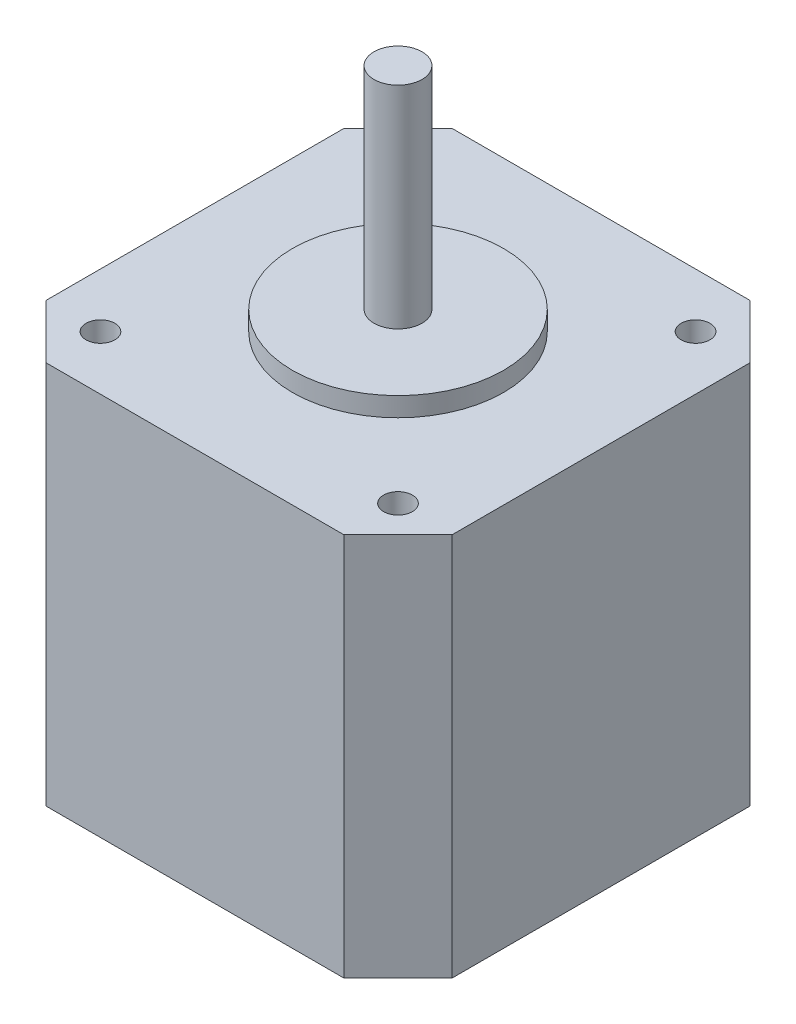
from build123d import *

# Parameters (mm, degrees)
SKETCH1_R           = 1.5
BOSS_EXTRUDE1_DEPTH = 40
SKETCH2_R           = 11
BOSS_EXTRUDE2_DEPTH = 2
SKETCH3_R           = 2.5
BOSS_EXTRUDE3_DEPTH = 22


with BuildPart() as part:
    # Sketch1 → Boss-Extrude1 (new body)
    with BuildSketch(Plane(origin=(0, 0, 0), x_dir=(1, 0, 0), z_dir=(0, 1, 0))):
        Polygon((-15.5, -21.15), (15.5, -21.15), (21.15, -15.5), (21.15, 15.5), (15.5, 21.15), (-15.5, 21.15), (-21.15, 15.5), (-21.15, -15.5), align=None)
        with Locations((-15.5, 15.5)):
            Circle(SKETCH1_R, mode=Mode.SUBTRACT)
        with Locations((15.5, -15.5)):
            Circle(SKETCH1_R, mode=Mode.SUBTRACT)
        with Locations((15.5, 15.5)):
            Circle(SKETCH1_R, mode=Mode.SUBTRACT)
        with Locations((-15.5, -15.5)):
            Circle(SKETCH1_R, mode=Mode.SUBTRACT)
    extrude(amount=BOSS_EXTRUDE1_DEPTH)

    # Sketch2 → Boss-Extrude2 (add)
    with BuildSketch(Plane(origin=(0, 40, 0), x_dir=(1, 0, 0), z_dir=(0, 1, 0))):
        Circle(SKETCH2_R)
    extrude(amount=BOSS_EXTRUDE2_DEPTH)

    # Sketch3 → Boss-Extrude3 (add)
    with BuildSketch(Plane(origin=(0, 42, 0), x_dir=(1, 0, 0), z_dir=(0, 1, 0))):
        Circle(SKETCH3_R)
    extrude(amount=BOSS_EXTRUDE3_DEPTH)


solid = part.part
